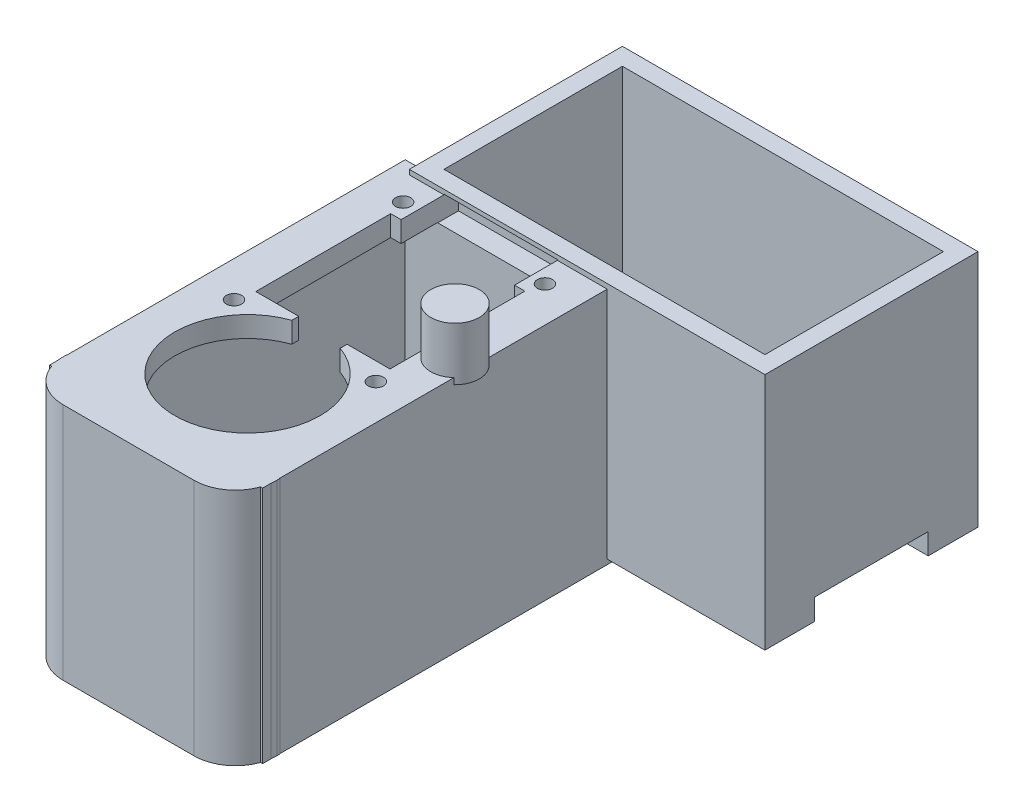
from build123d import *

# Parameters (mm, degrees)
S_BOX1_W        = 30.8
S_BOX1_H        = 34.5
BOSS_1_DEPTH    = 2.5
S_BOX2_W        = 30.8
S_BOX2_H        = 34.5
BOSS_2_DEPTH    = 2.5
S_BOX3_W        = 2.5
S_BOX3_H        = 34.5
BOSS_3_DEPTH    = 51.4
S_BOX4_W        = 2.5
S_BOX4_H        = 34.5
BOSS_4_DEPTH    = 51.4
S_BOX5_W        = 30.8
S_BOX5_H        = 3
BOSS_5_DEPTH    = 51.4
S_BOX6_W        = 2.5
S_BOX6_H        = 34.5
BOSS_6_DEPTH    = 30.8
S_BOX7_W        = 2.5
S_BOX7_H        = 34.5
BOSS_7_DEPTH    = 30.8
S_BOX8_W        = 51.4
S_BOX8_H        = 34.5
BOSS_8_DEPTH    = 2.5
S_BOX9_W        = 51.4
S_BOX9_H        = 34.5
BOSS_9_DEPTH    = 2.5
S_BOX10_W       = 51.4
S_BOX10_H       = 3
BOSS_10_DEPTH   = 30.8
BOSS_11_DEPTH   = 34.5
S_CYL12_R       = 3.5
BOSS_12_DEPTH   = 7.7
S_HOLE13_R      = 10.5
HOLE_13_DEPTH   = 3.2
S_CUT14_W       = 19.4
S_CUT14_H       = 3.15
POCKET_14_DEPTH = 19.5
S_CUT15_W       = 16.4
S_CUT15_H       = 3.15
POCKET_15_DEPTH = 8.3
S_CUT16_W       = 7
S_CUT16_H       = 3.15
POCKET_16_DEPTH = 11
S_HOLE17_R      = 1.1
HOLE_17_DEPTH   = 3.2
S_HOLE18_R      = 1.1
HOLE_18_DEPTH   = 3.2
S_HOLE19_R      = 1.1
HOLE_19_DEPTH   = 3.2
S_HOLE20_R      = 1.1
HOLE_20_DEPTH   = 3.2
S_HOLE21_R      = 10.5
HOLE_21_DEPTH   = 3.2
S_CUT22_W       = 19.5
S_CUT22_H       = 3.15
POCKET_22_DEPTH = 19.4
S_CUT23_W       = 8.3
S_CUT23_H       = 3.15
POCKET_23_DEPTH = 16.4
S_CUT24_W       = 11
S_CUT24_H       = 3.15
POCKET_24_DEPTH = 7
S_HOLE25_R      = 1.1
HOLE_25_DEPTH   = 3.2
S_HOLE26_R      = 1.1
HOLE_26_DEPTH   = 3.2
S_HOLE27_R      = 1.1
HOLE_27_DEPTH   = 3.2
S_HOLE28_R      = 1.1
HOLE_28_DEPTH   = 3.2


with BuildPart() as part:
    # S_box1 → Boss_1 (new body)
    with BuildSketch(Plane.XY.offset(-38.2)):
        with Locations((0, 20.15)):
            Rectangle(S_BOX1_W, S_BOX1_H)
    extrude(amount=BOSS_1_DEPTH)



with BuildPart() as body_2:
    # S_box2 → Boss_2 (new body)
    with BuildSketch(Plane.XY.offset(10.7)):
        with Locations((0, 20.15)):
            Rectangle(S_BOX2_W, S_BOX2_H)
    extrude(amount=BOSS_2_DEPTH)


with BuildPart() as part_1:
    add(part.part)

    add(body_2.part)  # Boss_3 merges body 2
    # S_box3 → Boss_3 (add)
    with BuildSketch(Plane.XY.offset(-38.2)):
        with Locations((-14.15, 20.15)):
            Rectangle(S_BOX3_W, S_BOX3_H)
    extrude(amount=BOSS_3_DEPTH)

    # S_box4 → Boss_4 (add)
    with BuildSketch(Plane.XY.offset(-38.2)):
        with Locations((14.15, 20.15)):
            Rectangle(S_BOX4_W, S_BOX4_H)
    extrude(amount=BOSS_4_DEPTH)

    # S_box5 → Boss_5 (add)
    with BuildSketch(Plane.XY.offset(-38.2)):
        with Locations((0, 35.9)):
            Rectangle(S_BOX5_W, S_BOX5_H)
    extrude(amount=BOSS_5_DEPTH)

    # S_box6 → Boss_6 (add)
    with BuildSketch(Plane.XY.offset(-67.4)):
        with Locations((-11.95, 20.85)):
            Rectangle(S_BOX6_W, S_BOX6_H)
    extrude(amount=BOSS_6_DEPTH)



with BuildPart() as body_2_2:
    # S_box7 → Boss_7 (new body)
    with BuildSketch(Plane.XY.offset(-67.4)):
        with Locations((36.95, 20.85)):
            Rectangle(S_BOX7_W, S_BOX7_H)
    extrude(amount=BOSS_7_DEPTH)


with BuildPart() as part_2:
    add(part_1.part)

    add(body_2_2.part)  # Boss_8 merges body 2 2
    # S_box8 → Boss_8 (add)
    with BuildSketch(Plane.XY.offset(-67.4)):
        with Locations((12.5, 20.85)):
            Rectangle(S_BOX8_W, S_BOX8_H)
    extrude(amount=BOSS_8_DEPTH)

    # S_box9 → Boss_9 (add)
    with BuildSketch(Plane.XY.offset(-39.1)):
        with Locations((12.5, 20.85)):
            Rectangle(S_BOX9_W, S_BOX9_H)
    extrude(amount=BOSS_9_DEPTH)

    # S_box10 → Boss_10 (add)
    with BuildSketch(Plane.XY.offset(-67.4)):
        with Locations((12.5, 5.1)):
            Rectangle(S_BOX10_W, S_BOX10_H)
    extrude(amount=BOSS_10_DEPTH)

    # S_prism11 → Boss_11 (add)
    with BuildSketch(Plane(origin=(0, 2.9, 0), x_dir=(1, 0, 0), z_dir=(0, 1, 0))):
        with BuildLine():
            Line((-15.45, -10.75), (15.45, -10.75))
            Line((15.45, -10.75), (15.45, -11.2))
            ThreePointArc((15.45, -11.2), (13.6926, -15.4426), (9.45, -17.2))
            Line((9.45, -17.2), (-9.45, -17.2))
            ThreePointArc((-9.45, -17.2), (-13.6926, -15.4426), (-15.45, -11.2))
            Line((-15.45, -11.2), (-15.45, -10.75))
        make_face()
    extrude(amount=BOSS_11_DEPTH)

    # S_cyl12 → Boss_12 (add)
    with BuildSketch(Plane(origin=(0, 36.5, 0), x_dir=(1, 0, 0), z_dir=(0, 1, 0))):
        with Locations((13, 17)):
            Circle(S_CYL12_R)
    extrude(amount=BOSS_12_DEPTH)

    # S_hole13 → Hole_13 (cut)
    with BuildSketch(Plane(origin=(0, 34.3, 0), x_dir=(1, 0, 0), z_dir=(0, 1, 0))):
        Circle(S_HOLE13_R)
    extrude(amount=HOLE_13_DEPTH, mode=Mode.SUBTRACT)

    # S_cut14 → Pocket_14 (cut)
    with BuildSketch(Plane.XY.offset(-30.4)):
        with Locations((0, 35.925)):
            Rectangle(S_CUT14_W, S_CUT14_H)
    extrude(amount=POCKET_14_DEPTH, mode=Mode.SUBTRACT)

    # S_cut15 → Pocket_15 (cut)
    with BuildSketch(Plane.XY.offset(-38.7)):
        with Locations((0, 35.925)):
            Rectangle(S_CUT15_W, S_CUT15_H)
    extrude(amount=POCKET_15_DEPTH, mode=Mode.SUBTRACT)

    # S_cut16 → Pocket_16 (cut)
    with BuildSketch(Plane.XY.offset(-11)):
        with Locations((0, 35.925)):
            Rectangle(S_CUT16_W, S_CUT16_H)
    extrude(amount=POCKET_16_DEPTH, mode=Mode.SUBTRACT)

    # S_hole17 → Hole_17 (cut)
    with BuildSketch(Plane(origin=(0, 34.3, 0), x_dir=(1, 0, 0), z_dir=(0, 1, 0))):
        with Locations((-10.25, 8.3)):
            Circle(S_HOLE17_R)
    extrude(amount=HOLE_17_DEPTH, mode=Mode.SUBTRACT)

    # S_hole18 → Hole_18 (cut)
    with BuildSketch(Plane(origin=(0, 34.3, 0), x_dir=(1, 0, 0), z_dir=(0, 1, 0))):
        with Locations((10.25, 8.3)):
            Circle(S_HOLE18_R)
    extrude(amount=HOLE_18_DEPTH, mode=Mode.SUBTRACT)

    # S_hole19 → Hole_19 (cut)
    with BuildSketch(Plane(origin=(0, 34.3, 0), x_dir=(1, 0, 0), z_dir=(0, 1, 0))):
        with Locations((-10.25, 32.75)):
            Circle(S_HOLE19_R)
    extrude(amount=HOLE_19_DEPTH, mode=Mode.SUBTRACT)

    # S_hole20 → Hole_20 (cut)
    with BuildSketch(Plane(origin=(0, 34.3, 0), x_dir=(1, 0, 0), z_dir=(0, 1, 0))):
        with Locations((10.25, 32.75)):
            Circle(S_HOLE20_R)
    extrude(amount=HOLE_20_DEPTH, mode=Mode.SUBTRACT)

    # S_hole21 → Hole_21 (cut)
    with BuildSketch(Plane(origin=(0, 3.5, 0), x_dir=(1, 0, 0), z_dir=(0, 1, 0))):
        with Locations((0, 52)):
            Circle(S_HOLE21_R)
    extrude(amount=HOLE_21_DEPTH, mode=Mode.SUBTRACT)

    # S_cut22 → Pocket_22 (cut)
    with BuildSketch(Plane.XY.offset(-61.7)):
        with Locations((20.65, 5.075)):
            Rectangle(S_CUT22_W, S_CUT22_H)
    extrude(amount=POCKET_22_DEPTH, mode=Mode.SUBTRACT)

    # S_cut23 → Pocket_23 (cut)
    with BuildSketch(Plane.XY.offset(-60.2)):
        with Locations((34.55, 5.075)):
            Rectangle(S_CUT23_W, S_CUT23_H)
    extrude(amount=POCKET_23_DEPTH, mode=Mode.SUBTRACT)

    # S_cut24 → Pocket_24 (cut)
    with BuildSketch(Plane.XY.offset(-55.5)):
        with Locations((5.5, 5.075)):
            Rectangle(S_CUT24_W, S_CUT24_H)
    extrude(amount=POCKET_24_DEPTH, mode=Mode.SUBTRACT)

    # S_hole25 → Hole_25 (cut)
    with BuildSketch(Plane(origin=(0, 3.5, 0), x_dir=(1, 0, 0), z_dir=(0, 1, 0))):
        with Locations((8.3, 62.25)):
            Circle(S_HOLE25_R)
    extrude(amount=HOLE_25_DEPTH, mode=Mode.SUBTRACT)

    # S_hole26 → Hole_26 (cut)
    with BuildSketch(Plane(origin=(0, 3.5, 0), x_dir=(1, 0, 0), z_dir=(0, 1, 0))):
        with Locations((8.3, 41.75)):
            Circle(S_HOLE26_R)
    extrude(amount=HOLE_26_DEPTH, mode=Mode.SUBTRACT)

    # S_hole27 → Hole_27 (cut)
    with BuildSketch(Plane(origin=(0, 3.5, 0), x_dir=(1, 0, 0), z_dir=(0, 1, 0))):
        with Locations((32.75, 62.25)):
            Circle(S_HOLE27_R)
    extrude(amount=HOLE_27_DEPTH, mode=Mode.SUBTRACT)

    # S_hole28 → Hole_28 (cut)
    with BuildSketch(Plane(origin=(0, 3.5, 0), x_dir=(1, 0, 0), z_dir=(0, 1, 0))):
        with Locations((32.75, 41.75)):
            Circle(S_HOLE28_R)
    extrude(amount=HOLE_28_DEPTH, mode=Mode.SUBTRACT)


solid = part_2.part
